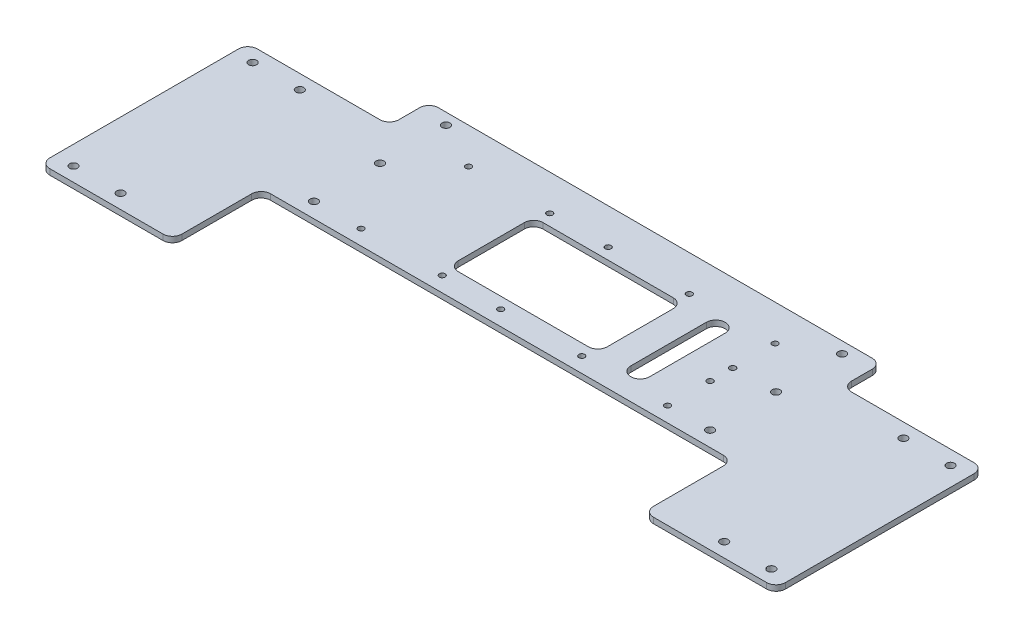
from build123d import *

# Parameters (mm, degrees)
SKETCH_1_W          = 240
SKETCH_1_H          = 166
EXTRUDE_1274_DEPTH  = 3
SKETCH_4_R          = 2.1
SKETCH_4_R_2        = 1.55
CUT_EXTRUDE_3_DEPTH = 251.068459046
SKETCH_5_R          = 1.55
SKETCH_5_R_2        = 10
SKETCH_5_W          = 79
SKETCH_5_H          = 45
CUT_EXTRUDE_4_DEPTH = 251.068459046
SKETCH_6_W          = 75
SKETCH_6_H          = 110
SKETCH_6_R          = 2.1
EXTRUDE_1_DEPTH     = 3
FILLET_1_R          = 5
SKETCH_8_R          = 39
CUT_EXTRUDE_6_DEPTH = 10
CUT_EXTRUDE_START   = -10
SKETCH_9_R          = 1.55
SKETCH_9_R_2        = 1.6
CUT_EXTRUDE_7_DEPTH = 10
SKETCH_10_W         = 250
SKETCH_10_H         = 82
CUT_EXTRUDE_8_DEPTH = 10
FILLET_4_R          = 5


with BuildPart() as part:
    # 草图1 → Extrude 1274 (new body)
    with BuildSketch(Plane(origin=(0, 0, 0), x_dir=(1, 0, 0), z_dir=(0, 1, 0))):
        with Locations((31.575924772, -115.871750732)):
            Rectangle(SKETCH_1_W, SKETCH_1_H)
    extrude(amount=EXTRUDE_1274_DEPTH)

    # 草图4 → 切除-拉伸3 (cut, through all)
    with BuildSketch(Plane(origin=(0, 3, 0), x_dir=(1, 0, 0), z_dir=(0, 1, 0))):
        with Locations((-73.424075228, -73.871750732)):
            Circle(SKETCH_4_R)
        with Locations((136.575924772, -178.871750732)):
            Circle(SKETCH_4_R)
        with Locations((-73.424075228, -108.871750732)):
            Circle(SKETCH_4_R)
        with Locations((-73.424075228, -143.871750732)):
            Circle(SKETCH_4_R)
        with Locations((-73.424075228, -178.871750732)):
            Circle(SKETCH_4_R)
        with Locations((136.575924772, -143.871750732)):
            Circle(SKETCH_4_R)
        with Locations((136.575924772, -108.871750732)):
            Circle(SKETCH_4_R)
        with Locations((136.575924772, -73.871750732)):
            Circle(SKETCH_4_R)
        with Locations((-73.424075228, -38.871750732)):
            Circle(SKETCH_4_R)
        with Locations((136.575924772, -38.871750732)):
            Circle(SKETCH_4_R)
        with Locations((77.075924772, -188.871750732)):
            Circle(SKETCH_4_R_2)
        with Locations((-13.924075228, -188.871750732)):
            Circle(SKETCH_4_R_2)
        with Locations((77.075924772, -153.871750732)):
            Circle(SKETCH_4_R_2)
        with Locations((-13.924075228, -153.871750732)):
            Circle(SKETCH_4_R_2)
    extrude(amount=-CUT_EXTRUDE_3_DEPTH, mode=Mode.SUBTRACT)

    # 草图5 → 切除-拉伸4 (cut, through all)
    with BuildSketch(Plane(origin=(0, 3, 0), x_dir=(1, 0, 0), z_dir=(0, 1, 0))):
        with Locations((-5.424075228, -51.871750732)):
            Circle(SKETCH_5_R)
        with Locations((68.575924772, -51.871750732)):
            Circle(SKETCH_5_R)
        with Locations((68.575924772, -108.871750732)):
            Circle(SKETCH_5_R)
        with Locations((-5.424075228, -108.871750732)):
            Circle(SKETCH_5_R)
        with Locations((-45.424075228, -143.871750732)):
            Circle(SKETCH_5_R_2)
        with Locations((108.575924772, -143.871750732)):
            Circle(SKETCH_5_R_2)
        with Locations((31.575924772, -80.371750732)):
            Rectangle(SKETCH_5_W, SKETCH_5_H)
        with BuildLine():
            Line((86.075924772, -100.371750732), (86.075924772, -60.371750732))
            ThreePointArc((86.075924772, -60.371750732), (91.075924772, -55.371750732), (96.075924772, -60.371750732))
            Line((96.075924772, -60.371750732), (96.075924772, -100.371750732))
            ThreePointArc((96.075924772, -100.371750732), (91.075924772, -105.371750732), (86.075924772, -100.371750732))
        make_face()
        with BuildLine():
            Line((1.575924772, -117.871750732), (61.575924772, -117.871750732))
            ThreePointArc((61.575924772, -117.871750732), (68.575924772, -124.871750732), (61.575924772, -131.871750732))
            Line((61.575924772, -131.871750732), (41.575924772, -131.871750732))
            ThreePointArc((41.575924772, -131.871750732), (31.575924772, -141.871750732), (21.575924772, -131.871750732))
            Line((21.575924772, -131.871750732), (1.575924772, -131.871750732))
            ThreePointArc((1.575924772, -131.871750732), (-5.424075228, -124.871750732), (1.575924772, -117.871750732))
        make_face()
    extrude(amount=-CUT_EXTRUDE_4_DEPTH, mode=Mode.SUBTRACT)

    # 草图6 → 凸台-拉伸1 (add)
    # profile 1 of 2: a face of its own
    with BuildSketch(Plane(origin=(0, 0, 0), x_dir=(1, 0, 0), z_dir=(0, 1, 0))):
        with Locations((-125.924075228, -108.871750732)):
            Rectangle(SKETCH_6_W, SKETCH_6_H)
        with Locations((-153.424075228, -61.371750732)):
            Circle(SKETCH_6_R, mode=Mode.SUBTRACT)
        with Locations((-153.424075228, -156.371750732)):
            Circle(SKETCH_6_R, mode=Mode.SUBTRACT)
        with Locations((-128.424075228, -61.371750732)):
            Circle(SKETCH_6_R, mode=Mode.SUBTRACT)
        with Locations((-128.424075228, -156.371750732)):
            Circle(SKETCH_6_R, mode=Mode.SUBTRACT)
    # profile 2 of 2: a face of its own
    with BuildSketch(Plane(origin=(0, 0, 0), x_dir=(1, 0, 0), z_dir=(0, 1, 0))):
        with Locations((189.075924772, -108.871750732)):
            Rectangle(SKETCH_6_W, SKETCH_6_H)
        with Locations((216.575924772, -156.371750732)):
            Circle(SKETCH_6_R, mode=Mode.SUBTRACT)
        with Locations((216.575924772, -61.371750732)):
            Circle(SKETCH_6_R, mode=Mode.SUBTRACT)
        with Locations((191.575924772, -156.371750732)):
            Circle(SKETCH_6_R, mode=Mode.SUBTRACT)
        with Locations((191.575924772, -61.371750732)):
            Circle(SKETCH_6_R, mode=Mode.SUBTRACT)
    extrude(amount=EXTRUDE_1_DEPTH)

    # 圆角1
    fillet_1_edges = [part.edges().sort_by_distance(p)[0] for p in [
        (71.075924772, 1.5, 102.871750732),
        (-7.924075228, 1.5, 102.871750732),
        (-7.924075228, 1.5, 57.871750732),
        (71.075924772, 1.5, 57.871750732),
        (151.575924772, 1.5, 32.871750732),
        (-88.424075228, 1.5, 32.871750732),
        (151.575924772, 1.5, 53.871750732),
        (151.575924772, 1.5, 163.871750732),
        (-88.424075228, 1.5, 163.871750732),
        (-88.424075228, 1.5, 53.871750732),
        (226.575924772, 1.5, 53.871750732),
        (226.575924772, 1.5, 163.871750732),
        (151.575924772, 1.5, 198.871750732),
        (-88.424075228, 1.5, 198.871750732),
        (-163.424075228, 1.5, 53.871750732),
        (-163.424075228, 1.5, 163.871750732),
        (41.575924772, 1.5, 131.871750732),
        (21.575924772, 1.5, 131.871750732),
    ]]
    fillet(fillet_1_edges, radius=FILLET_1_R)

    # 草图8 → 切除-拉伸6 (cut)
    with BuildSketch(Plane(origin=(0, 3, 0), x_dir=(1, 0, 0), z_dir=(0, 1, 0))):
        with Locations((31.575924772, -158.205226673)):
            Circle(SKETCH_8_R)
    extrude(amount=-CUT_EXTRUDE_6_DEPTH, mode=Mode.SUBTRACT)

    # 草图9 → 切除-拉伸7 (cut)
    with BuildSketch(Plane.XZ.offset(CUT_EXTRUDE_START)):
        with Locations((68.575924772, 108.871750732)):
            Circle(SKETCH_9_R)
        with Locations((-48.424075228, 108.871750732)):
            Circle(SKETCH_9_R)
        with Locations((25.575924772, 108.871750732)):
            Circle(SKETCH_9_R)
        with Locations((25.575924772, 51.871750732)):
            Circle(SKETCH_9_R)
        with Locations((-48.424075228, 51.871750732)):
            Circle(SKETCH_9_R)
        with Locations((114.075924772, 51.871750732)):
            Circle(SKETCH_9_R)
        with Locations((114.075924772, 74.371750732)):
            Circle(SKETCH_9_R_2)
        with Locations((114.075924772, 86.371750732)):
            Circle(SKETCH_9_R_2)
        with Locations((114.075924772, 108.871750732)):
            Circle(SKETCH_9_R)
        with Locations((114.075924772, 131.371750732)):
            Circle(SKETCH_9_R_2)
        with Locations((68.075924772, 131.371750732)):
            Circle(SKETCH_9_R_2)
    extrude(amount=CUT_EXTRUDE_7_DEPTH, mode=Mode.SUBTRACT)

    # 草图10 → 切除-拉伸8 (cut)
    with BuildSketch(Plane.XZ):
        with Locations((31.575924772, 157.871750732)):
            Rectangle(SKETCH_10_W, SKETCH_10_H)
    extrude(amount=-CUT_EXTRUDE_8_DEPTH, mode=Mode.SUBTRACT)

    # 圆角4
    fillet_4_edges = [part.edges().sort_by_distance(p)[0] for p in [
        (156.575924772, 1.5, 116.871750732),
        (156.575924772, 1.5, 163.871750732),
        (-93.424075228, 1.5, 116.871750732),
        (-93.424075228, 1.5, 163.871750732),
    ]]
    fillet(fillet_4_edges, radius=FILLET_4_R)


solid = part.part
